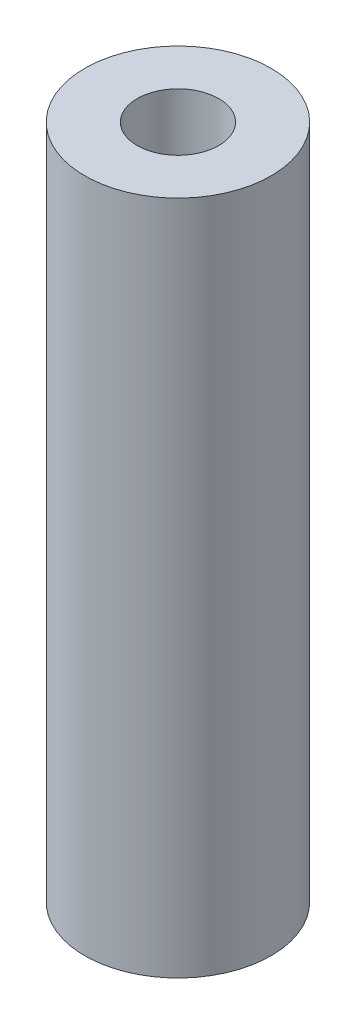
from build123d import *

# Parameters (mm, degrees)
SKETCH1_R           = 4
SKETCH1_R_2         = 1.75
BOSS_EXTRUDE1_DEPTH = 29


with BuildPart() as part:
    # Sketch1 → Boss-Extrude1 (new body)
    with BuildSketch(Plane(origin=(0, 0, 0), x_dir=(1, 0, 0), z_dir=(0, 1, 0))):
        Circle(SKETCH1_R)
        Circle(SKETCH1_R_2, mode=Mode.SUBTRACT)
    extrude(amount=BOSS_EXTRUDE1_DEPTH)


solid = part.part
